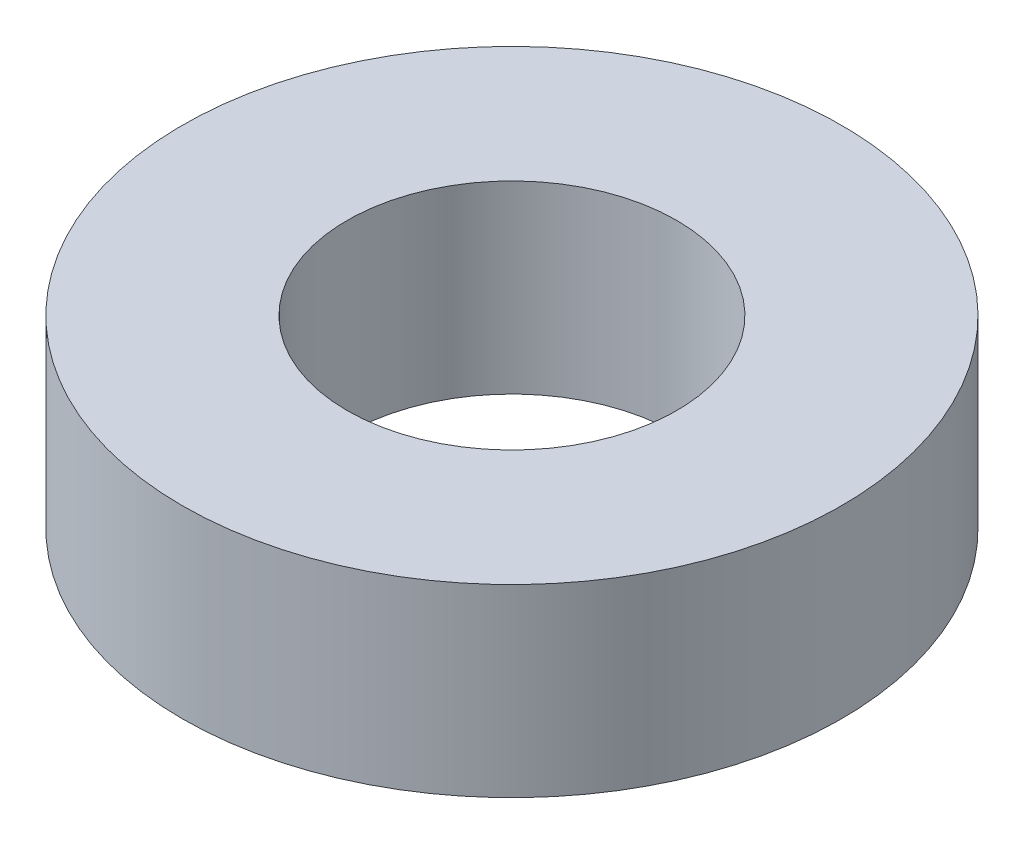
from build123d import *

# Parameters (mm, degrees)
SKETCH1_R           = 50
BOSS_EXTRUDE1_DEPTH = 28
SKETCH2_R           = 25
CUT_EXTRUDE1_DEPTH  = 77.052613367


with BuildPart() as part:
    # Sketch1 → Boss-Extrude1 (new body)
    with BuildSketch(Plane(origin=(0, 0, 0), x_dir=(1, 0, 0), z_dir=(0, 1, 0))):
        Circle(SKETCH1_R)
    extrude(amount=BOSS_EXTRUDE1_DEPTH)

    # Sketch2 → Cut-Extrude1 (cut, through all)
    with BuildSketch(Plane(origin=(0, 0, 0), x_dir=(1, 0, 0), z_dir=(0, 1, 0))):
        Circle(SKETCH2_R)
    extrude(amount=CUT_EXTRUDE1_DEPTH, mode=Mode.SUBTRACT)


solid = part.part
